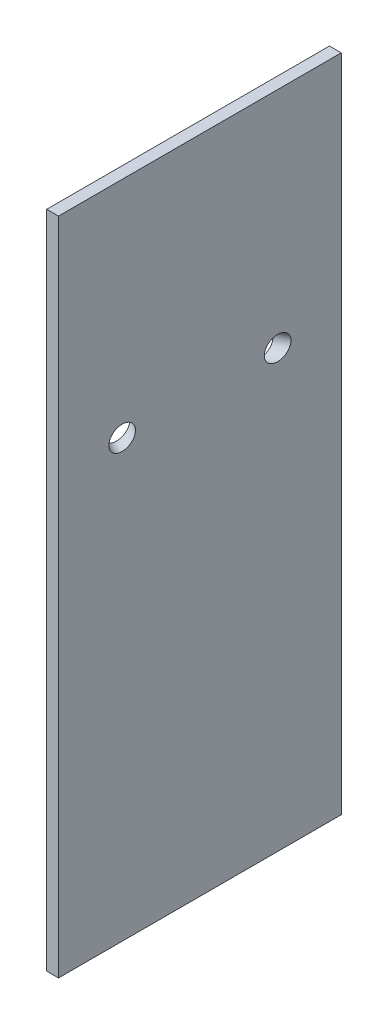
from build123d import *

# Parameters (mm, degrees)
SKETCH1_W           = 304.8
SKETCH1_H           = 711.2
BOSS_EXTRUDE1_DEPTH = 6.35
CAVITY1_START       = 23.660689199
CAVITY1_OUTLINE_R   = 12.7
CAVITY1_DEPTH       = 27.76582142
CAVITY1_2_OUTLINE_R = 12.7
CAVITY1_2_DEPTH     = 27.76582142


# Read off the part's stored shape, not the designer's step: Cavity1
with BuildPart() as part:
    # Sketch1 → Boss-Extrude1 (new, symmetric)
    with BuildSketch(Plane(origin=(0, 0, 0), x_dir=(0, 0, -1), z_dir=(1, 0, 0))):
        Rectangle(SKETCH1_W, SKETCH1_H)
    extrude(amount=BOSS_EXTRUDE1_DEPTH, both=True)

    # Cavity1 outline → Cavity1 (cut)
    with BuildSketch(Plane(origin=(0, 0, 0), x_dir=(0.4667586195581355, 0, 0.8843847528469629), z_dir=(0.8843847528469628, 0, -0.4667586195581359)).offset(CAVITY1_START)):
        with Locations((-71.135241933, -114.3)):
            Circle(CAVITY1_OUTLINE_R)
    extrude(amount=CAVITY1_DEPTH, mode=Mode.SUBTRACT)

    # Cavity1 2 outline → Cavity1 2 (cut)
    with BuildSketch(Plane(origin=(0, 0, 0), x_dir=(0.4667586195581373, 0, -0.8843847528469619), z_dir=(0.8843847528469618, 0, 0.4667586195581379)).offset(CAVITY1_START)):
        with Locations((-71.135241933, 114.3)):
            Circle(CAVITY1_2_OUTLINE_R)
    extrude(amount=CAVITY1_2_DEPTH, mode=Mode.SUBTRACT)


solid = part.part
